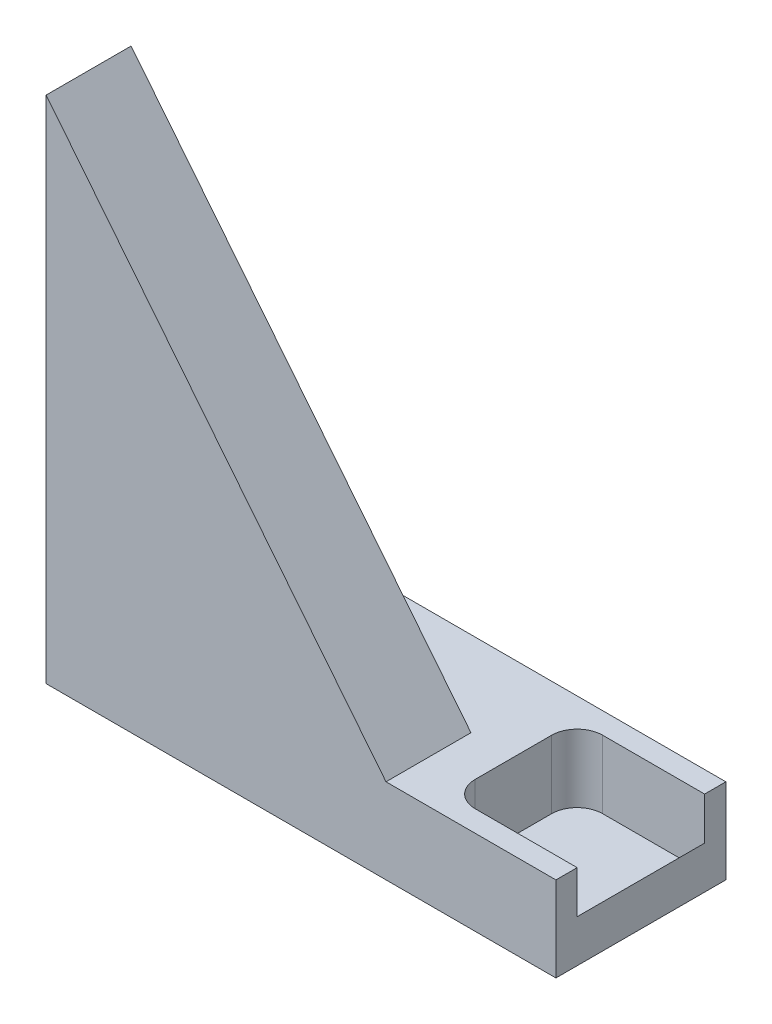
from build123d import *

# Parameters (mm, degrees)
AUFSATZ_LINEAR_AUSTRAGEN1_DEPTH      = 10
SKIZZE2_W                            = 60
SKIZZE2_H                            = 10
AUFSATZ_LINEAR_AUSTRAGEN2_DEPTH      = 10
SCHNITT_LINEAR_AUSTRAGEN2_DEPTH      = 7.5
SCHNITT_LINEAR_AUSTRAGEN2_DEPTH_BACK = 7.5
FASE1_SIZE                           = 2
VERRUNDUNG1_R                        = 3


with BuildPart() as part:
    # Skizze1 → Aufsatz-Linear austragen1 (new body)
    with BuildSketch(Plane.XY):
        Polygon((40, 10), (0, 60), (0, 0), (60, 0), (60, 10), align=None)
    extrude(amount=AUFSATZ_LINEAR_AUSTRAGEN1_DEPTH)

    # Skizze2 → Aufsatz-Linear austragen2 (add)
    with BuildSketch(Plane(origin=(0, 0, 0), x_dir=(-1, 0, 0), z_dir=(0, 0, -1))):
        with Locations((-30, 5)):
            Rectangle(SKIZZE2_W, SKIZZE2_H)
    extrude(amount=AUFSATZ_LINEAR_AUSTRAGEN2_DEPTH)

    # Skizze4 → Schnitt-Linear austragen2 (cut, two sides: drawn at the far end of the back side and taken through both)
    with BuildSketch(Plane.XY.offset(-SCHNITT_LINEAR_AUSTRAGEN2_DEPTH_BACK)):
        Polygon((60, 10), (45, 10), (45, 2), (58, 2), (58, 5), (60, 5), align=None)
    extrude(amount=SCHNITT_LINEAR_AUSTRAGEN2_DEPTH + SCHNITT_LINEAR_AUSTRAGEN2_DEPTH_BACK, mode=Mode.SUBTRACT)

    # Fase1
    fase1_edges = [part.edges().sort_by_distance(p)[0] for p in [
        (58, 5, 0),
    ]]
    chamfer(fase1_edges, length=FASE1_SIZE - 0.0001)  # a hair under: the kernel refuses the full size

    # Verrundung1
    verrundung1_edges = [part.edges().sort_by_distance(p)[0] for p in [
        (45, 6, -7.5),
        (45, 6, 7.5),
    ]]
    fillet(verrundung1_edges, radius=VERRUNDUNG1_R)


solid = part.part
